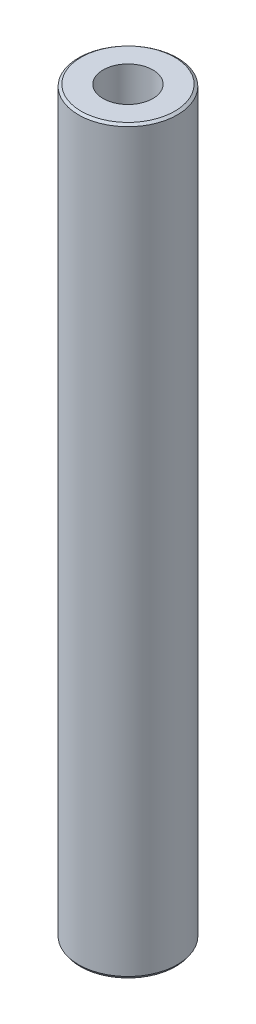
from build123d import *
from OCP.BRepFilletAPI import BRepFilletAPI_MakeChamfer

# Parameters (mm, degrees)
SKETCH1_R           = 32.5
BOSS_EXTRUDE1_DEPTH = 486.896096196
SKETCH2_R           = 16.355019688
CUT_EXTRUDE1_DEPTH  = 490.060638869
CHAMFER1_SIZE       = 1.2138421
CHAMFER1_SIZE2      = 1.727906396


with BuildPart() as part:
    # Sketch1 → Boss-Extrude1 (new body)
    with BuildSketch(Plane(origin=(0, 0, 0), x_dir=(1, 0, 0), z_dir=(0, 1, 0))):
        Circle(SKETCH1_R)
    extrude(amount=BOSS_EXTRUDE1_DEPTH)

    # Sketch2 → Cut-Extrude1 (cut, through all)
    with BuildSketch(Plane(origin=(0, 0, 0), x_dir=(1, 0, 0), z_dir=(0, 1, 0))):
        Circle(SKETCH2_R)
    extrude(amount=CUT_EXTRUDE1_DEPTH, mode=Mode.SUBTRACT)

    # Chamfer1: one chamfer whose edges measure the first distance from different faces: ONE call of the kernel's chamfer builder (chamfer() names one face for all edges)
    chamfer1_edges_1 = [part.edges().sort_by_distance(p)[0] for p in [
        (-32.5, 486.896096196, 0),
    ]]
    chamfer1_side_1 = [part.faces().sort_by_distance(p)[0] for p in [
        (-32.5, 243.448048098, 0),
    ]]
    chamfer1_edges_2 = [part.edges().sort_by_distance(p)[0] for p in [
        (-32.5, 0, 0),
    ]]
    chamfer1_side_2 = [part.faces().sort_by_distance(p)[0] for p in [
        (-31.580761184, 0, 0),
    ]]
    chamfer1 = BRepFilletAPI_MakeChamfer(part.part.solid().wrapped)
    for e in chamfer1_edges_1:
        chamfer1.Add(CHAMFER1_SIZE, CHAMFER1_SIZE2, e.wrapped, chamfer1_side_1[0].wrapped)  # the first distance lies on this face
    for e in chamfer1_edges_2:
        chamfer1.Add(CHAMFER1_SIZE, CHAMFER1_SIZE2, e.wrapped, chamfer1_side_2[0].wrapped)  # the first distance lies on this face
    add(Compound.cast(chamfer1.Shape()), mode=Mode.REPLACE)


solid = part.part
